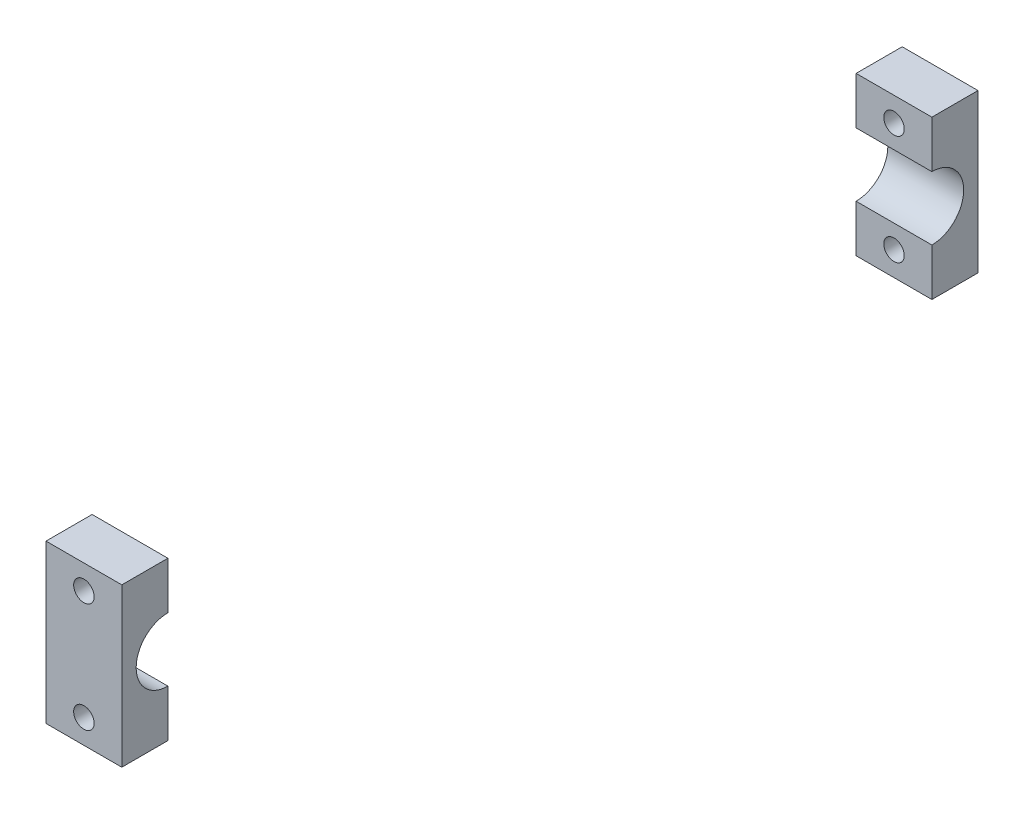
from build123d import *

# Parameters (mm, degrees)
SKETCH2_W               = 180
SKETCH2_H               = 9
BOSS_EXTRUDE1_DEPTH     = 14.8
SKETCH7_W               = 90
SKETCH7_H               = 4.5
CUT_EXTRUDE1_DEPTH      = 92.319713096
FILLET1_R               = 8
BOSS_EXTRUDE2_DEPTH     = 14.8
CUT_EXTRUDE2_DEPTH      = 175.130679781
CUT_EXTRUDE2_DEPTH_BACK = 175.130679781
SKETCH11_R              = 2
CUT_EXTRUDE3_DEPTH      = 107.467114171
CUT_EXTRUDE3_DEPTH_BACK = 107.467114171


with BuildPart() as part:
    # Sketch2 → Boss-Extrude1 (new body)
    with BuildSketch(Plane(origin=(0, 0, 0), x_dir=(0, 0, -1), z_dir=(1, 0, 0))):
        Rectangle(SKETCH2_W, SKETCH2_H)
    extrude(amount=BOSS_EXTRUDE1_DEPTH)

    # Sketch7 → Cut-Extrude1 (cut, through all)
    with BuildSketch(Plane(origin=(14.8, 0, 0), x_dir=(0, 0, -1), z_dir=(1, 0, 0))):
        with Locations((0, -2.25)):
            Rectangle(SKETCH7_W, SKETCH7_H)
    extrude(amount=-CUT_EXTRUDE1_DEPTH, mode=Mode.SUBTRACT)

    # Fillet1
    # the kernel refuses this fillet: 8 mm, written as the material it adds along each edge
    with BuildSketch(Plane(origin=(14.8, 0, -45), x_dir=(0, -1, 0), z_dir=(-1, 0, 0))) as fillet1_piece_1:
        with BuildLine():
            CenterArc((8, 7.193747285), FILLET1_R, 180, 64.055520228)
            Line((0, 7.193747285), (-0.16, 7.193747285))
            Line((-0.16, 7.193747285), (-0.16, 0))
            Line((-0.16, 0), (0, -0.16))
            ThreePointArc((0, -0.16), (2.25, -0.16), (4.43, -0.143874946))
            Line((4.43, -0.143874946), (4.5, 0))
        make_face()
    extrude(amount=14.8)
    with BuildSketch(Plane(origin=(14.8, 0, 45), x_dir=(0, -1, 0), z_dir=(-1, 0, 0))) as fillet1_piece_2:
        with BuildLine():
            CenterArc((8, -7.193747285), FILLET1_R, 115.944479772, 64.055520228)
            Line((0, -7.193747285), (-0.16, -7.193747285))
            Line((-0.16, -7.193747285), (-0.16, 0))
            Line((-0.16, 0), (0, 0.16))
            ThreePointArc((0, 0.16), (2.25, 0.16), (4.43, 0.143874946))
            Line((4.43, 0.143874946), (4.5, 0))
        make_face()
    extrude(amount=14.8)

    # Sketch8 → Boss-Extrude2 (add)
    with BuildSketch(Plane(origin=(14.8, 0, 0), x_dir=(0, 0, -1), z_dir=(1, 0, 0))):
        with BuildLine():
            Line((83.579, -39.5), (83.579, -54.92))
            Line((83.579, -54.92), (74.579, -54.92))
            Line((74.579, -54.92), (74.579, -45.7))
            ThreePointArc((74.579, -45.7), (80.779, -39.5), (74.579, -33.3))
            Line((74.579, -33.3), (74.579, -4.5))
            Line((74.579, -4.5), (83.579, -4.5))
            Line((83.579, -4.5), (83.579, -39.5))
        make_face()
        with BuildLine():
            Line((-74.579, -54.92), (-74.579, -45.7))
            ThreePointArc((-74.579, -45.7), (-80.779, -39.5), (-74.579, -33.3))
            Line((-74.579, -33.3), (-74.579, -4.5))
            Line((-74.579, -4.5), (-83.579, -4.5))
            Line((-83.579, -4.5), (-83.579, -39.5))
            Line((-83.579, -39.5), (-83.579, -54.92))
            Line((-83.579, -54.92), (-74.579, -54.92))
        make_face()
    extrude(amount=-BOSS_EXTRUDE2_DEPTH)

    # Sketch11 → Cut-Extrude2 (cut, two sides: drawn at the far end of the back side and taken through both)
    with BuildSketch(Plane(origin=(0, 0, 74.579), x_dir=(-1, 0, 0), z_dir=(0, 0, -1)).offset(-CUT_EXTRUDE2_DEPTH_BACK)):
        with Locations(Location((-7.4, -28.8, 0), (0, 0, 180))):
            Circle(SKETCH11_R)
        with Locations(Location((-7.4, -50.2, 0), (0, 0, 180))):
            Circle(SKETCH11_R)
    extrude(amount=CUT_EXTRUDE2_DEPTH + CUT_EXTRUDE2_DEPTH_BACK, mode=Mode.SUBTRACT)

    # Sketch12 → Cut-Extrude3 (cut, two sides: drawn at the far end of the back side and taken through both)
    with BuildSketch(Plane.ZY.offset(-CUT_EXTRUDE3_DEPTH_BACK)):
        Polygon((96.986162818, 8.741450318), (-95.153164269, 8.741450318), (-95.153164269, -16.038890922), (-95.153164269, -24.08), (74.579, -24.08), (96.986162818, -24.08), (96.986162818, -16.038890922), (96.986162818, -4.5), align=None)
    extrude(amount=CUT_EXTRUDE3_DEPTH + CUT_EXTRUDE3_DEPTH_BACK, mode=Mode.SUBTRACT)


with BuildPart() as cut_extrude3_piece_1:
    # of the separate pieces the step leaves, piece 1, a body of its own (cut_extrude3_pieces)
    add(part.part.solids().sort_by_distance((14.8, -24.08, -83.579))[0])


with BuildPart() as cut_extrude3_piece_2:
    # of the separate pieces the step leaves, piece 2, a body of its own (cut_extrude3_pieces)
    add(part.part.solids().sort_by_distance((14.8, -33.3, 74.579))[0])


solid = Compound([cut_extrude3_piece_1.part, cut_extrude3_piece_2.part])
